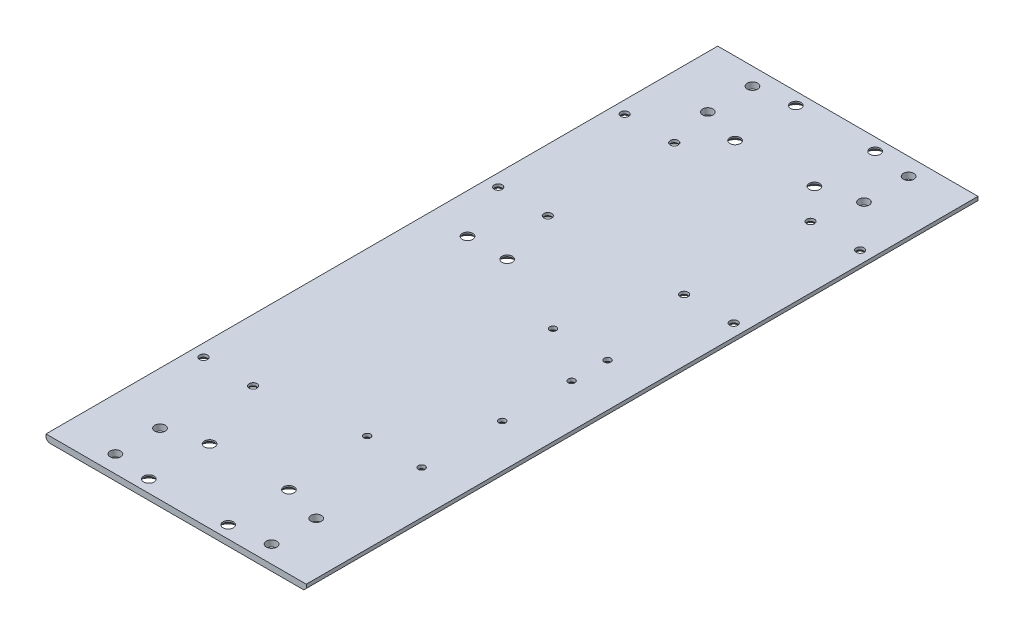
from build123d import *

# Parameters (mm, degrees)
SKETCH_1_W          = 105
SKETCH_1_H          = 271
SKETCH_1_R          = 2.1
EXTRUDE_1_DEPTH     = 2.5
SKETCH_2_R          = 1.6
SKETCH_2_R_2        = 2.1
SKETCH_2_R_3        = 1.35
CUT_EXTRUDE_1_DEPTH = 10
CHAMFER_1_SIZE      = 1.9
CHAMFER_2_SIZE      = 1.4
CHAMFER_3_SIZE      = 1.15
CHAMFER_4_SIZE      = 1


with BuildPart() as part:
    # 草图1 → 凸台-拉伸1 (new body)
    with BuildSketch(Plane(origin=(0, 0, 0), x_dir=(1, 0, 0), z_dir=(0, 1, 0))):
        Rectangle(SKETCH_1_W, SKETCH_1_H)
        with Locations((16, -130.5)):
            Circle(SKETCH_1_R, mode=Mode.SUBTRACT)
        with Locations((-16, -130.5)):
            Circle(SKETCH_1_R, mode=Mode.SUBTRACT)
        with Locations((16, 130.5)):
            Circle(SKETCH_1_R, mode=Mode.SUBTRACT)
        with Locations((-16, 130.5)):
            Circle(SKETCH_1_R, mode=Mode.SUBTRACT)
        with Locations((-16, -106)):
            Circle(SKETCH_1_R, mode=Mode.SUBTRACT)
        with Locations((16, -106)):
            Circle(SKETCH_1_R, mode=Mode.SUBTRACT)
        with Locations((16, 106)):
            Circle(SKETCH_1_R, mode=Mode.SUBTRACT)
        with Locations((-16, 106)):
            Circle(SKETCH_1_R, mode=Mode.SUBTRACT)
    extrude(amount=EXTRUDE_1_DEPTH)

    # 草图2 → 切除-拉伸1 (cut)
    with BuildSketch(Plane(origin=(0, 2.5, 0), x_dir=(1, 0, 0), z_dir=(0, 1, 0))):
        with Locations((47.5, 41.95)):
            Circle(SKETCH_2_R)
        with Locations((27.5, 41.95)):
            Circle(SKETCH_2_R)
        with Locations((47.5, 92.95)):
            Circle(SKETCH_2_R)
        with Locations((27.5, 92.95)):
            Circle(SKETCH_2_R)
        with Locations((-20.5, 18.55)):
            Circle(SKETCH_2_R_2)
        with Locations((-36.5, 18.55)):
            Circle(SKETCH_2_R_2)
        with Locations((-27.5, -76.95)):
            Circle(SKETCH_2_R)
        with Locations((-47.5, -76.95)):
            Circle(SKETCH_2_R)
        with Locations((-27.5, 92.95)):
            Circle(SKETCH_2_R)
        with Locations((-47.5, 92.95)):
            Circle(SKETCH_2_R)
        with Locations((-27.5, 41.95)):
            Circle(SKETCH_2_R)
        with Locations((-47.5, 41.95)):
            Circle(SKETCH_2_R)
        with Locations((-31.5, 128.5)):
            Circle(SKETCH_2_R_2)
        with Locations((-31.5, 110.5)):
            Circle(SKETCH_2_R_2)
        with Locations((31.5, 110.5)):
            Circle(SKETCH_2_R_2)
        with Locations((31.5, 128.5)):
            Circle(SKETCH_2_R_2)
        with Locations((31.5, -128.5)):
            Circle(SKETCH_2_R_2)
        with Locations((31.5, -110.5)):
            Circle(SKETCH_2_R_2)
        with Locations((-31.5, -110.5)):
            Circle(SKETCH_2_R_2)
        with Locations((-31.5, -128.5)):
            Circle(SKETCH_2_R_2)
        with Locations((13.000000181, 3.549999997)):
            Circle(SKETCH_2_R_3)
        with Locations((35, 3.549999997)):
            Circle(SKETCH_2_R_3)
        with Locations((35, -10.950003407)):
            Circle(SKETCH_2_R_3)
        with Locations((35, -38.950003407)):
            Circle(SKETCH_2_R_3)
        with Locations((35, -71.45)):
            Circle(SKETCH_2_R_3)
        with Locations((13.000000181, -71.45)):
            Circle(SKETCH_2_R_3)
    extrude(amount=-CUT_EXTRUDE_1_DEPTH, mode=Mode.SUBTRACT)

    # 倒角1
    chamfer_1_edges = [part.edges().sort_by_distance(p)[0] for p in [
        (-18.1, 0, -106),
        (-18.1, 0, -130.5),
        (13.9, 0, -106),
        (13.9, 0, -130.5),
        (-38.6, 0, -18.55),
        (-22.6, 0, -18.55),
        (-18.1, 0, 130.5),
        (-18.1, 0, 106),
        (13.9, 0, 130.5),
        (13.9, 0, 106),
    ]]
    chamfer(chamfer_1_edges, length=CHAMFER_1_SIZE)

    # 倒角2
    chamfer_2_edges = [part.edges().sort_by_distance(p)[0] for p in [
        (-49.1, 0, 76.95),
        (-29.1, 0, 76.95),
        (-49.1, 0, -41.95),
        (-29.1, 0, -41.95),
        (25.9, 0, -41.95),
        (45.9, 0, -41.95),
        (45.9, 0, -92.95),
        (25.9, 0, -92.95),
        (-49.1, 0, -92.95),
        (-29.1, 0, -92.95),
    ]]
    chamfer(chamfer_2_edges, length=CHAMFER_2_SIZE)

    # 倒角3
    chamfer_3_edges = [part.edges().sort_by_distance(p)[0] for p in [
        (11.650000181, 0, 71.45),
        (33.65, 0, 71.45),
        (33.65, 0, 38.950003407),
        (33.65, 0, 10.950003407),
        (11.650000181, 0, -3.549999997),
        (33.65, 0, -3.549999997),
    ]]
    chamfer(chamfer_3_edges, length=CHAMFER_3_SIZE)

    # 倒角4
    chamfer_4_edges = [part.edges().sort_by_distance(p)[0] for p in [
        (52.5, 0, 0),
        (-52.5, 0, 0),
    ]]
    chamfer(chamfer_4_edges, length=CHAMFER_4_SIZE)


solid = part.part
